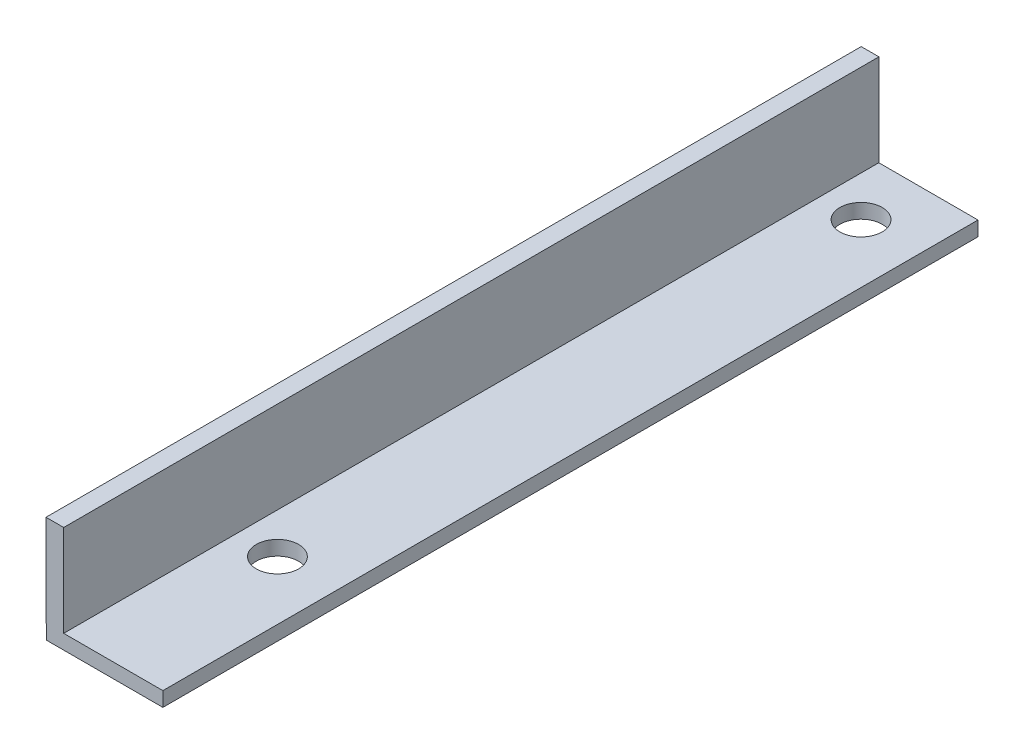
from build123d import *

# Parameters (mm, degrees)
SKETCH1_W           = 12.7
SKETCH1_H           = 88.9
SKETCH1_R           = 2.31
BOSS_EXTRUDE1_DEPTH = 1.5875
SKETCH3_W           = 1.92980329
SKETCH3_H           = 88.910165889
BOSS_EXTRUDE3_DEPTH = 10


with BuildPart() as part:
    # Sketch1 → Boss-Extrude1 (new body)
    with BuildSketch(Plane(origin=(0, 0, 0), x_dir=(1, 0, 0), z_dir=(0, 1, 0))):
        with Locations((6.35, 57.087542426)):
            Rectangle(SKETCH1_W, SKETCH1_H)
        with Locations((6.293214881, 95.187542426)):
            Circle(SKETCH1_R, mode=Mode.SUBTRACT)
        with Locations((6.293214881, 31.537542426)):
            Circle(SKETCH1_R, mode=Mode.SUBTRACT)
    extrude(amount=BOSS_EXTRUDE1_DEPTH)

    # Sketch3 → Boss-Extrude3 (add)
    with BuildSketch(Plane(origin=(0, 1.5875, 0), x_dir=(1, 0, 0), z_dir=(0, 1, 0))):
        with Locations((0.917585704, 57.092625371)):
            Rectangle(SKETCH3_W, SKETCH3_H)
    extrude(amount=BOSS_EXTRUDE3_DEPTH)


solid = part.part
